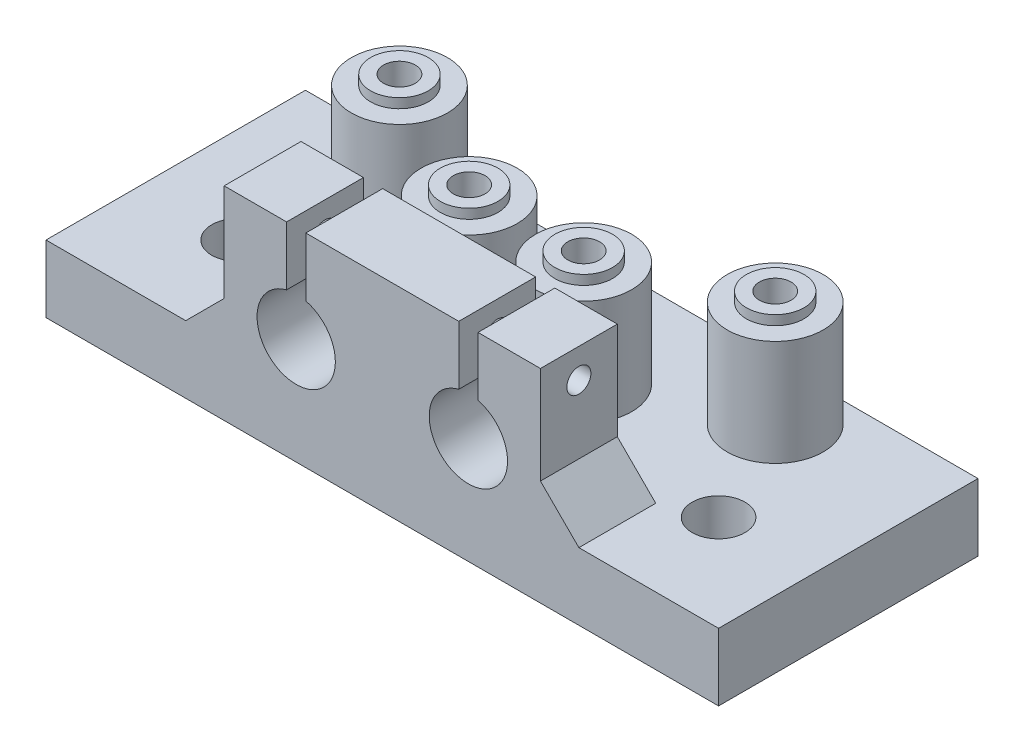
from build123d import *

# Parameters (mm, degrees)
BOSS_EXTRUDE1_DEPTH      = 3
BOSS_EXTRUDE2_DEPTH      = 8
CHAMFER1_SIZE            = 4
M3X0_5_TAPPED_HOLE1_D    = 2.5
CHAMFER1_OF_MIRROR1_SIZE = 4
BOSS_EXTRUDE3_REACH      = 34.14
SKETCH7_W                = 8
SKETCH7_H                = 14.15
SKETCH7_R                = 1.25
SKETCH8_R                = 5
BOSS_EXTRUDE4_DEPTH      = 12
CUT_EXTRUDE1_START       = -1
SKETCH9_R                = 5
SKETCH9_R_2              = 3
CUT_EXTRUDE1_DEPTH       = 1
SKETCH12_W               = 15.25
SKETCH12_H               = 27
BOSS_EXTRUDE5_DEPTH      = 3
M4X0_7_TAPPED_HOLE1_D    = 3.3
M5_CLEARANCE_HOLE3_D     = 5.5
DELETEFACE1_START        = 2
DELETEFACE1_DEPTH        = 8
MOVE_FACE1_BY            = 4


# Read off the part's stored shape, not the designer's step: DeleteFace1
with BuildPart() as part:
    # Sketch1 → Boss-Extrude1 (new body)
    with BuildSketch(Plane(origin=(0, 0, 0), x_dir=(1, 0, 0), z_dir=(0, 1, 0))):
        Polygon((19.75, 10), (19.75, -10), (-19.75, -10), (-19.75, 10), (-19.75, 17), (19.75, 17), align=None)
    extrude(amount=BOSS_EXTRUDE1_DEPTH)

    # Sketch4 → Boss-Extrude2 (add)
    with BuildSketch(Plane.XY.offset(10)):
        with BuildLine():
            Line((1.46, 17.15), (1.46, 3))
            Line((1.46, 3), (8.960000005, 3))
            ThreePointArc((8.960000005, 3), (4.916271098, 6.571133381), (7.96, 11.02539555))
            Line((7.96, 11.02539555), (7.96, 17.15))
            Line((7.96, 17.15), (1.46, 17.15))
        make_face()
        with BuildLine():
            ThreePointArc((13.035, 7.075), (11.841460135, 4.193539869), (8.960000005, 3))
            Line((8.960000005, 3), (16.46, 3))
            Line((16.46, 3), (16.46, 17.15))
            Line((16.46, 17.15), (9.96, 17.15))
            Line((9.96, 17.15), (9.96, 11.02539555))
            ThreePointArc((9.96, 11.02539555), (12.175635629, 9.578060627), (13.035, 7.075))
        make_face()
    boss_extrude2 = extrude(amount=-BOSS_EXTRUDE2_DEPTH)

    # Chamfer1
    # the kernel refuses this chamfer: 4 mm, written as the material it adds along each edge
    with BuildSketch(Plane(origin=(16.46, 3, 10), x_dir=(0.9996219169112968, -0.027495876610586917, 0), z_dir=(0, 0, -1))) as chamfer1_piece_1_section:
        Polygon((CHAMFER1_SIZE * 0.999621916911, -CHAMFER1_SIZE * 0.0274958766106), (-CHAMFER1_SIZE * 0.0274958766106, -CHAMFER1_SIZE * 0.999621916911), (0, 0), align=None)
    chamfer1_piece_1 = extrude(amount=8, mode=Mode.PRIVATE)
    chamfer1_piece_1 = split(chamfer1_piece_1, bisect_by=Plane(origin=(19.75, 4.372732245, 6), z_dir=(-1, 0, 0)), keep=Keep.TOP, mode=Mode.PRIVATE)
    add(chamfer1_piece_1)

    # M3x0.5 Tapped Hole1 (through all)
    with Locations(Plane.ZY.offset(-1.46)):
        with Locations((6, 14.087697775)):
            m3x0_5_tapped_hole1 = Hole(M3X0_5_TAPPED_HOLE1_D / 2)

    # Mirror1: Boss-Extrude2, M3x0.5 Tapped Hole1 across plane
    add(boss_extrude2.mirror(Plane(origin=(0, 0, 0), x_dir=(0, 0, 1), z_dir=(1, 0, 0))))
    add(m3x0_5_tapped_hole1.mirror(Plane(origin=(0, 0, 0), x_dir=(0, 0, 1), z_dir=(1, 0, 0))), mode=Mode.SUBTRACT)

    # Chamfer1 of Mirror1
    # the kernel refuses this chamfer: 4 mm, written as the material it adds along each edge
    with BuildSketch(Plane(origin=(-16.46, 3, 10), x_dir=(-0.9996219169112968, -0.027495876610586917, 0), z_dir=(0, 0, -1))) as chamfer1_of_mirror1_piece_1_section:
        Polygon((CHAMFER1_OF_MIRROR1_SIZE * 0.999621916911, CHAMFER1_OF_MIRROR1_SIZE * 0.0274958766106), (-CHAMFER1_OF_MIRROR1_SIZE * 0.0274958766106, CHAMFER1_OF_MIRROR1_SIZE * 0.999621916911), (0, 0), align=None)
    chamfer1_of_mirror1_piece_1 = extrude(amount=8, mode=Mode.PRIVATE)
    chamfer1_of_mirror1_piece_1 = split(chamfer1_of_mirror1_piece_1, bisect_by=Plane(origin=(-19.75, 4.372732245, 6), z_dir=(1, 0, 0)), keep=Keep.TOP, mode=Mode.PRIVATE)
    add(chamfer1_of_mirror1_piece_1)

    # Sketch7 → Boss-Extrude3 (add, up to next)
    with BuildSketch(Plane(origin=(-1.46, 0, 0), x_dir=(0, 0, -1), z_dir=(1, 0, 0)), mode=Mode.PRIVATE) as boss_extrude3_sk1:
        with Locations((-6, 10.075)):
            Rectangle(SKETCH7_W, SKETCH7_H)
        with Locations(Location((-6, 14.087697775, 0), (0, 0, 180))):
            Circle(SKETCH7_R, mode=Mode.SUBTRACT)
    boss_extrude3_tool1 = extrude(boss_extrude3_sk1.sketch, amount=BOSS_EXTRUDE3_REACH, mode=Mode.PRIVATE) - part.part
    add(boss_extrude3_tool1.solids().sort_by_distance((-1.46, 9.893108, 6))[0])

    # Sketch8 → Boss-Extrude4 (add)
    with BuildSketch(Plane(origin=(0, 3, 0), x_dir=(1, 0, 0), z_dir=(0, 1, 0))):
        with Locations(Location((-5.96, 5, 0), (0, 0, 90))):
            Circle(SKETCH8_R)
        with Locations(Location((5.96, 5, 0), (0, 0, 90))):
            Circle(SKETCH8_R)
        with Locations(Location((-19.554616806, 11.339273926, 0), (0, 0, 92.239496679))):
            Circle(SKETCH8_R)
        with Locations(Location((19.554616806, 11.339273926, 0), (0, 0, 87.760503321))):
            Circle(SKETCH8_R)
    extrude(amount=BOSS_EXTRUDE4_DEPTH)

    # Sketch9 → Cut-Extrude1 (cut)
    # profile 1 of 4: a face of its own
    with BuildSketch(Plane(origin=(0, 15, 0), x_dir=(1, 0, 0), z_dir=(0, 1, 0)).offset(CUT_EXTRUDE1_START)):
        with Locations(Location((5.96, 5, 0), (0, 0, 90))):
            Circle(SKETCH9_R)
        with Locations(Location((5.96, 5, 0), (0, 0, 270))):
            Circle(SKETCH9_R_2, mode=Mode.SUBTRACT)
    # profile 2 of 4: a face of its own
    with BuildSketch(Plane(origin=(0, 15, 0), x_dir=(1, 0, 0), z_dir=(0, 1, 0)).offset(CUT_EXTRUDE1_START)):
        with Locations(Location((-5.96, 5, 0), (0, 0, 90))):
            Circle(SKETCH9_R)
        with Locations(Location((-5.96, 5, 0), (0, 0, 270))):
            Circle(SKETCH9_R_2, mode=Mode.SUBTRACT)
    # profile 3 of 4: a face of its own
    with BuildSketch(Plane(origin=(0, 15, 0), x_dir=(1, 0, 0), z_dir=(0, 1, 0)).offset(CUT_EXTRUDE1_START)):
        with Locations(Location((-19.554616806, 11.339273926, 0), (0, 0, 92.239496679))):
            Circle(SKETCH9_R)
        with Locations(Location((-19.554616806, 11.339273926, 0), (0, 0, 270))):
            Circle(SKETCH9_R_2, mode=Mode.SUBTRACT)
    # profile 4 of 4: a face of its own
    with BuildSketch(Plane(origin=(0, 15, 0), x_dir=(1, 0, 0), z_dir=(0, 1, 0)).offset(CUT_EXTRUDE1_START)):
        with Locations(Location((19.554616806, 11.339273926, 0), (0, 0, 87.760503321))):
            Circle(SKETCH9_R)
        with Locations(Location((19.554616806, 11.339273926, 0), (0, 0, 270))):
            Circle(SKETCH9_R_2, mode=Mode.SUBTRACT)
    extrude(amount=CUT_EXTRUDE1_DEPTH, mode=Mode.SUBTRACT)

    # Sketch12 → Boss-Extrude5 (add)
    with BuildSketch(Plane.XZ):
        with Locations((-27.375, -3.5)):
            Rectangle(SKETCH12_W, SKETCH12_H)
        with Locations((27.375, -3.5)):
            Rectangle(SKETCH12_W, SKETCH12_H)
    extrude(amount=-BOSS_EXTRUDE5_DEPTH)

    # M4x0.7 Tapped Hole1 (through all)
    with Locations(Plane.XZ):
        with Locations((-5.96, -5), (5.96, -5), (-19.554616806, -11.339273926), (19.554616806, -11.339273926)):
            Hole(M4X0_7_TAPPED_HOLE1_D / 2)

    # M5 Clearance Hole3 (through all)
    with Locations(Plane(origin=(0, 3, 0), x_dir=(1, 0, 0), z_dir=(0, 1, 0))):
        with Locations((25, 0), (-25, 0)):
            Hole(M5_CLEARANCE_HOLE3_D / 2)

    # DeleteFace1 outline → DeleteFace1 (add)
    with BuildSketch(Plane.XY.offset(DELETEFACE1_START)):
        Polygon((-20.46, 3), (-19.75, 3), (-19.75, 3.71), align=None)
        Polygon((20.46, 3), (19.75, 3.71), (19.75, 3), align=None)
    extrude(amount=DELETEFACE1_DEPTH)

    # Move Face1: a face moved outward by 4.0
    extrude(part.faces().sort_by_distance((0, 0, -3.503622632))[0], amount=MOVE_FACE1_BY, dir=(0, -1, 0))


solid = part.part
